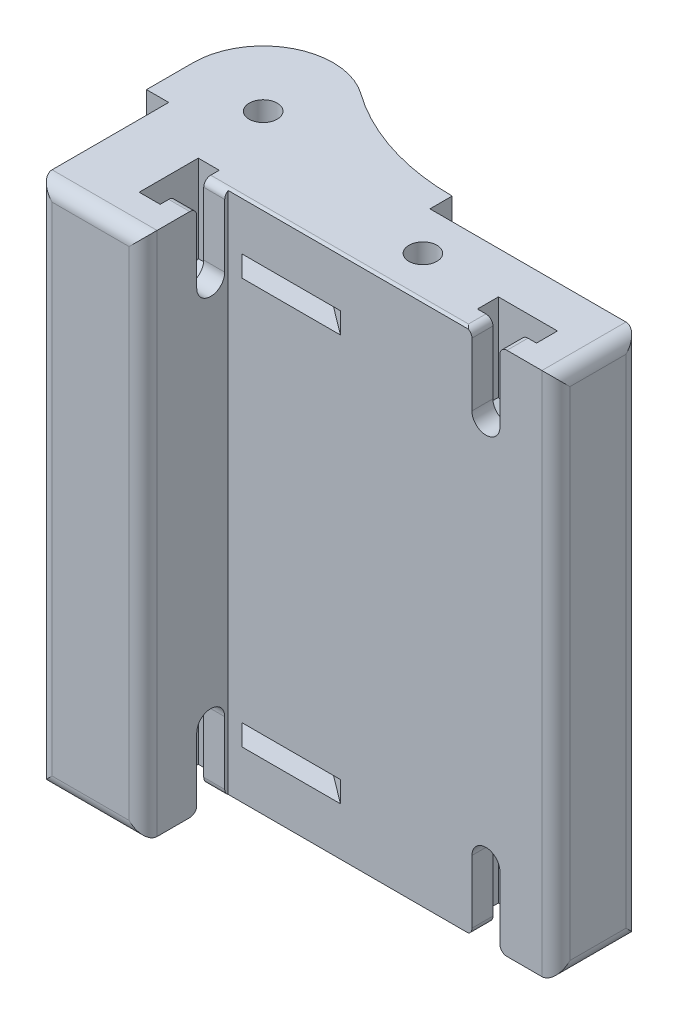
from build123d import *

# Parameters (mm, degrees)
BOSS_EXTRUDE1_DEPTH = 75
SKETCH2_R           = 2
CUT_EXTRUDE1_DEPTH  = 15
SKETCH4_R           = 2
CUT_EXTRUDE2_DEPTH  = 12
SKETCH3_R           = 2
CUT_EXTRUDE3_DEPTH  = 75
CUT_EXTRUDE4_START  = -3
CUT_EXTRUDE4_DEPTH  = 3
CUT_EXTRUDE5_START  = -3
CUT_EXTRUDE5_DEPTH  = 3
CUT_EXTRUDE6_START  = -3
CUT_EXTRUDE6_DEPTH  = 3
CUT_EXTRUDE7_START  = -3
CUT_EXTRUDE7_DEPTH  = 3
CUT_EXTRUDE8_START  = -7
CUT_EXTRUDE8_DEPTH  = 3
FILLET2_START       = 5.175
FILLET2_DEPTH       = 42.1845
FILLET2_START_2     = 10.175
FILLET2_2_DEPTH     = 3.491666667
FILLET2_3_DEPTH     = 37.825
FILLET3_R           = 2


with BuildPart() as part:
    # Sketch1 → Boss-Extrude1 (new body)
    with BuildSketch(Plane(origin=(0, 0, 0), x_dir=(1, 0, 0), z_dir=(0, 1, 0))):
        with BuildLine():
            Line((-6.825, -6.666666667), (-6.825, -25.333333333))
            Line((-6.825, -25.333333333), (8.175, -25.333333333))
            Line((8.175, -25.333333333), (8.175, -13.175))
            Line((8.175, -13.175), (55, -13.175))
            Line((55, -13.175), (55, -1.175))
            Line((55, -1.175), (25, -1.175))
            Line((25, -1.175), (25, 2))
            ThreePointArc((25, 2), (14.923352523, 3.572976633), (5.805515239, 8.142235123))
            ThreePointArc((5.805515239, 8.142235123), (3.047757271, 9.524241472), (0, 10))
            ThreePointArc((0, 10), (-7.071067812, 7.071067812), (-10, 0))
            Line((-10, 0), (-10, -6.666666667))
            Line((-10, -6.666666667), (-6.825, -6.666666667))
        make_face()
    extrude(amount=BOSS_EXTRUDE1_DEPTH)

    # Sketch2 → Cut-Extrude1 (cut)
    with BuildSketch(Plane.ZY.offset(6.825)):
        with Locations((15.666666667, 65)):
            Circle(SKETCH2_R)
    cut_extrude1 = extrude(amount=-CUT_EXTRUDE1_DEPTH, mode=Mode.SUBTRACT)

    # Sketch4 → Cut-Extrude2 (cut)
    with BuildSketch(Plane(origin=(0, 0, 1.175), x_dir=(-1, 0, 0), z_dir=(0, 0, -1))):
        with Locations((-45, 65)):
            Circle(SKETCH4_R)
    cut_extrude2 = extrude(amount=-CUT_EXTRUDE2_DEPTH, mode=Mode.SUBTRACT)

    # Sketch3 → Cut-Extrude3 (cut)
    with BuildSketch(Plane(origin=(0, 75, 0), x_dir=(1, 0, 0), z_dir=(0, 1, 0))):
        with Locations(Location((1, -1, 0), (0, 0, 270))):
            Circle(SKETCH3_R)
        with Locations(Location((30, -7.175, 0), (0, 0, 270))):
            Circle(SKETCH3_R)
    extrude(amount=-CUT_EXTRUDE3_DEPTH, mode=Mode.SUBTRACT)

    # Sketch5 → Cut-Extrude4 (cut)
    with BuildSketch(Plane(origin=(8.175, 0, 0), x_dir=(0, 0, -1), z_dir=(1, 0, 0)).offset(CUT_EXTRUDE4_START)):
        Polygon((-19.885416667, 62.564303552), (-15.666666667, 60.128607104), (-11.447916667, 62.564303552), (-11.447916667, 75), (-19.885416667, 75), align=None)
    cut_extrude4 = extrude(amount=-CUT_EXTRUDE4_DEPTH, mode=Mode.SUBTRACT)

    # Sketch6 → Cut-Extrude5 (cut)
    with BuildSketch(Plane(origin=(8.175, 0, 0), x_dir=(0, 0, -1), z_dir=(1, 0, 0)).offset(CUT_EXTRUDE5_START)):
        with BuildLine():
            Line((-13.666666667, 65), (-13.666666667, 75))
            Line((-13.666666667, 75), (-17.666666667, 75))
            Line((-17.666666667, 75), (-17.666666667, 65))
            ThreePointArc((-17.666666667, 65), (-15.666666667, 67), (-13.666666667, 65))
        make_face()
    cut_extrude5 = extrude(amount=CUT_EXTRUDE5_DEPTH, mode=Mode.SUBTRACT)

    # Sketch7 → Cut-Extrude6 (cut)
    with BuildSketch(Plane.XY.offset(13.175).offset(CUT_EXTRUDE6_START)):
        Polygon((40.78125, 62.564303552), (45, 60.128607104), (49.21875, 62.564303552), (49.21875, 75), (40.78125, 75), align=None)
    cut_extrude6 = extrude(amount=-CUT_EXTRUDE6_DEPTH, mode=Mode.SUBTRACT)

    # Sketch8 → Cut-Extrude7 (cut)
    with BuildSketch(Plane.XY.offset(13.175).offset(CUT_EXTRUDE7_START)):
        with BuildLine():
            Line((47, 65), (47, 75))
            Line((47, 75), (43, 75))
            Line((43, 75), (43, 65))
            ThreePointArc((43, 65), (45, 67), (47, 65))
        make_face()
    cut_extrude7 = extrude(amount=CUT_EXTRUDE7_DEPTH, mode=Mode.SUBTRACT)

    # Sketch10 → Cut-Extrude8 (cut)
    with BuildSketch(Plane(origin=(0, 75, 0), x_dir=(1, 0, 0), z_dir=(0, 1, 0)).offset(CUT_EXTRUDE8_START)):
        Polygon((0.411941919, -5.835768444), (10.175, -13.175), (24.216737808, -13.175), (5.48192736, 0.908610985), (1.588058081, 3.835768444), (-2.893869279, 1.927157459), (-3.48192736, -2.908610985), align=None)
        Polygon((25.78125, -4.739303552), (25.78125, -1.175), (34.21875, -1.175), (34.21875, -4.739303552), (34.21875, -9.610696448), (30, -12.046392896), (25.78125, -9.610696448), align=None)
    cut_extrude8 = extrude(amount=-CUT_EXTRUDE8_DEPTH, mode=Mode.SUBTRACT)

    # Mirror2: Cut-Extrude1, Cut-Extrude2, Cut-Extrude4, Cut-Extrude5, Cut-Extrude6, Cut-Extrude7, Cut-Extrude8 across plane
    add(cut_extrude1.mirror(Plane.ZX.offset(37.5)), mode=Mode.SUBTRACT)
    add(cut_extrude2.mirror(Plane.ZX.offset(37.5)), mode=Mode.SUBTRACT)
    add(cut_extrude4.mirror(Plane.ZX.offset(37.5)), mode=Mode.SUBTRACT)
    add(cut_extrude5.mirror(Plane.ZX.offset(37.5)), mode=Mode.SUBTRACT)
    add(cut_extrude6.mirror(Plane.ZX.offset(37.5)), mode=Mode.SUBTRACT)
    add(cut_extrude7.mirror(Plane.ZX.offset(37.5)), mode=Mode.SUBTRACT)
    add(cut_extrude8.mirror(Plane.ZX.offset(37.5)), mode=Mode.SUBTRACT)

    # Fillet2: read off the stored shape, not the designer's step
    # Fillet2 outline → Fillet2 (cut)
    with BuildSketch(Plane.YZ.offset(FILLET2_START)):
        with BuildLine():
            Line((1, 13.666666667), (0, 13.666666667))
            Line((0, 13.666666667), (0, 12.666666667))
            ThreePointArc((0, 12.666666667), (0.292893219, 13.373773448), (1, 13.666666667))
        make_face()
        with BuildLine():
            ThreePointArc((1, 17.666666667), (0.292893218, 17.959559886), (0, 18.666666667))
            Line((0, 18.666666667), (0, 17.666666667))
            Line((0, 17.666666667), (1, 17.666666667))
        make_face()
    extrude(amount=FILLET2_DEPTH, mode=Mode.SUBTRACT)

    # Fillet2 2 outline → Fillet2 2 (cut)
    with BuildSketch(Plane.XY.offset(FILLET2_START_2)):
        with BuildLine():
            Line((47, 1), (47, 0))
            Line((47, 0), (47.3595, 0))
            Line((47.3595, 0), (48, 0))
            ThreePointArc((48, 0), (47.292893219, 0.292893219), (47, 1))
        make_face()
        with BuildLine():
            Line((48, 75), (47, 75))
            Line((47, 75), (47, 74))
            ThreePointArc((47, 74), (47.292893219, 74.707106781), (48, 75))
        make_face()
        with BuildLine():
            Line((43, 75), (42, 75))
            ThreePointArc((42, 75), (42.707106781, 74.707106781), (43, 74))
            Line((43, 74), (43, 75))
        make_face()
        with BuildLine():
            ThreePointArc((43, 1), (42.707106781, 0.292893219), (42, 0))
            Line((42, 0), (43, 0))
            Line((43, 0), (43, 1))
        make_face()
    extrude(amount=FILLET2_2_DEPTH, mode=Mode.SUBTRACT)

    # Fillet2 3 outline → Fillet2 3 (cut)
    with BuildSketch(Plane.YZ.offset(FILLET2_START)):
        with BuildLine():
            Line((74, 17.666666667), (75, 17.666666667))
            Line((75, 17.666666667), (75, 18.666666667))
            ThreePointArc((75, 18.666666667), (74.707106782, 17.959559886), (74, 17.666666667))
        make_face()
        with BuildLine():
            Line((75, 12.666666667), (75, 13.666666667))
            Line((75, 13.666666667), (74, 13.666666667))
            ThreePointArc((74, 13.666666667), (74.707106781, 13.373773448), (75, 12.666666667))
        make_face()
    extrude(amount=FILLET2_3_DEPTH, mode=Mode.SUBTRACT)

    # Fillet3
    fillet3_edges = [part.edges().sort_by_distance(p)[0] for p in [
        (55, 0, 7.175),
        (0.675, 0, 25.333333333),
        (55, 37.5, 1.175),
        (55, 37.5, 13.175),
        (8.175, 37.5, 25.333333333),
        (-6.825, 37.5, 25.333333333),
        (0.675, 75, 25.333333333),
        (55, 75, 7.175),
    ]]
    fillet(fillet3_edges, radius=FILLET3_R)


solid = part.part
